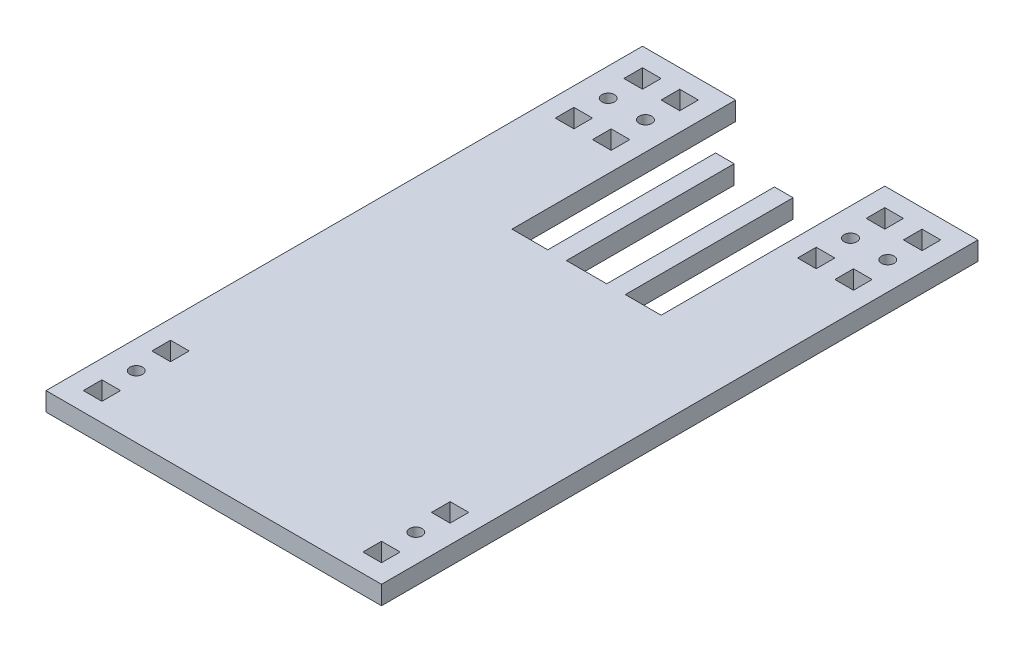
from build123d import *

# Parameters (mm, degrees)
SKETCH1_W           = 6.35
SKETCH1_H           = 6.35
SKETCH1_R           = 2.159
BOSS_EXTRUDE1_DEPTH = 6.35


with BuildPart() as part:
    # Sketch1 → Boss-Extrude1 (new body)
    with BuildSketch(Plane(origin=(0, 0, 0), x_dir=(1, 0, 0), z_dir=(0, 1, 0))):
        Polygon((-25.4, 101.6), (-57.15, 101.6), (-57.15, -101.6), (57.15, -101.6), (57.15, 101.6), (25.4, 101.6), (25.4, 25.4), (13.208, 25.4), (13.208, 82.55), (6.858, 82.55), (6.858, 25.4), (-6.858, 25.4), (-6.858, 82.55), (-13.208, 82.55), (-13.208, 25.4), (-25.4, 25.4), align=None)
        with Locations((-47.625, -92.075)):
            Rectangle(SKETCH1_W, SKETCH1_H, mode=Mode.SUBTRACT)
        with Locations((-47.625, -80.391)):
            Circle(SKETCH1_R, mode=Mode.SUBTRACT)
        with Locations((-47.625, -68.707)):
            Rectangle(SKETCH1_W, SKETCH1_H, mode=Mode.SUBTRACT)
        with Locations((47.625, -92.075)):
            Rectangle(SKETCH1_W, SKETCH1_H, mode=Mode.SUBTRACT)
        with Locations((47.625, -80.391)):
            Circle(SKETCH1_R, mode=Mode.SUBTRACT)
        with Locations((47.625, -68.707)):
            Rectangle(SKETCH1_W, SKETCH1_H, mode=Mode.SUBTRACT)
        with Locations((-47.625, 68.707)):
            Rectangle(SKETCH1_W, SKETCH1_H, mode=Mode.SUBTRACT)
        with Locations((-34.925, 68.707)):
            Rectangle(SKETCH1_W, SKETCH1_H, mode=Mode.SUBTRACT)
        with Locations((-47.625, 80.391)):
            Circle(SKETCH1_R, mode=Mode.SUBTRACT)
        with Locations((-47.625, 92.075)):
            Rectangle(SKETCH1_W, SKETCH1_H, mode=Mode.SUBTRACT)
        with Locations((-34.925, 80.391)):
            Circle(SKETCH1_R, mode=Mode.SUBTRACT)
        with Locations((-34.925, 92.075)):
            Rectangle(SKETCH1_W, SKETCH1_H, mode=Mode.SUBTRACT)
        with Locations((34.925, 68.707)):
            Rectangle(SKETCH1_W, SKETCH1_H, mode=Mode.SUBTRACT)
        with Locations((47.625, 68.707)):
            Rectangle(SKETCH1_W, SKETCH1_H, mode=Mode.SUBTRACT)
        with Locations((34.925, 80.391)):
            Circle(SKETCH1_R, mode=Mode.SUBTRACT)
        with Locations((34.925, 92.075)):
            Rectangle(SKETCH1_W, SKETCH1_H, mode=Mode.SUBTRACT)
        with Locations((47.625, 80.391)):
            Circle(SKETCH1_R, mode=Mode.SUBTRACT)
        with Locations((47.625, 92.075)):
            Rectangle(SKETCH1_W, SKETCH1_H, mode=Mode.SUBTRACT)
    extrude(amount=BOSS_EXTRUDE1_DEPTH)


solid = part.part
